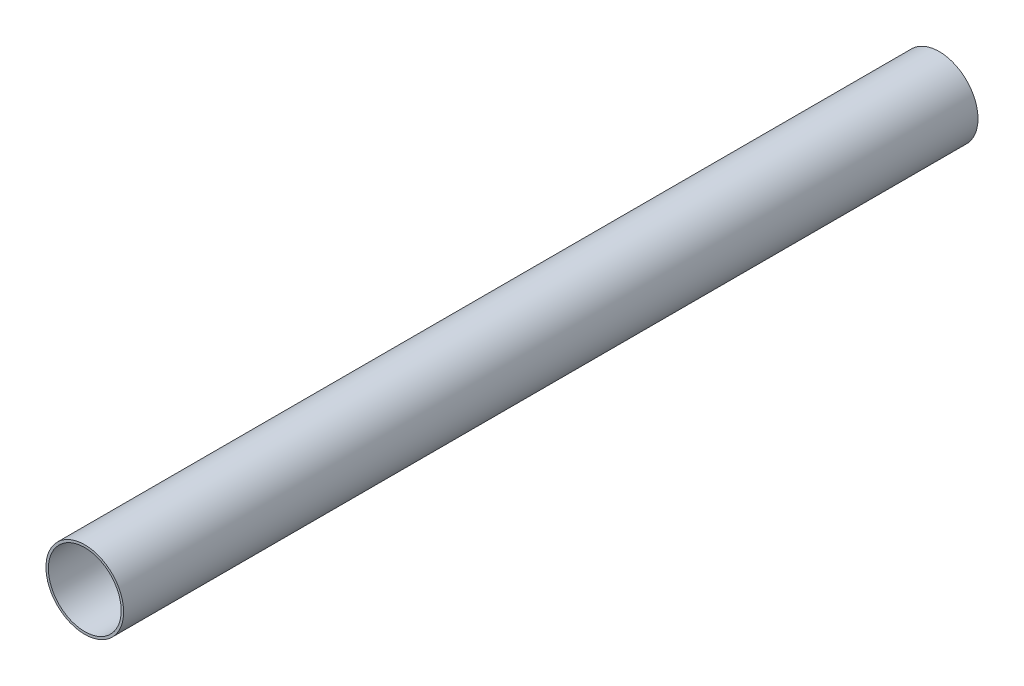
from build123d import *

# Parameters (mm, degrees)
SKETCH1_R           = 25.4
SKETCH1_R_2         = 23.8125
BOSS_EXTRUDE1_DEPTH = 279.358506179


with BuildPart() as part:
    # Sketch1 → Boss-Extrude1 (new, symmetric)
    with BuildSketch(Plane.XY):
        Circle(SKETCH1_R)
        Circle(SKETCH1_R_2, mode=Mode.SUBTRACT)
    extrude(amount=BOSS_EXTRUDE1_DEPTH, both=True)


solid = part.part
